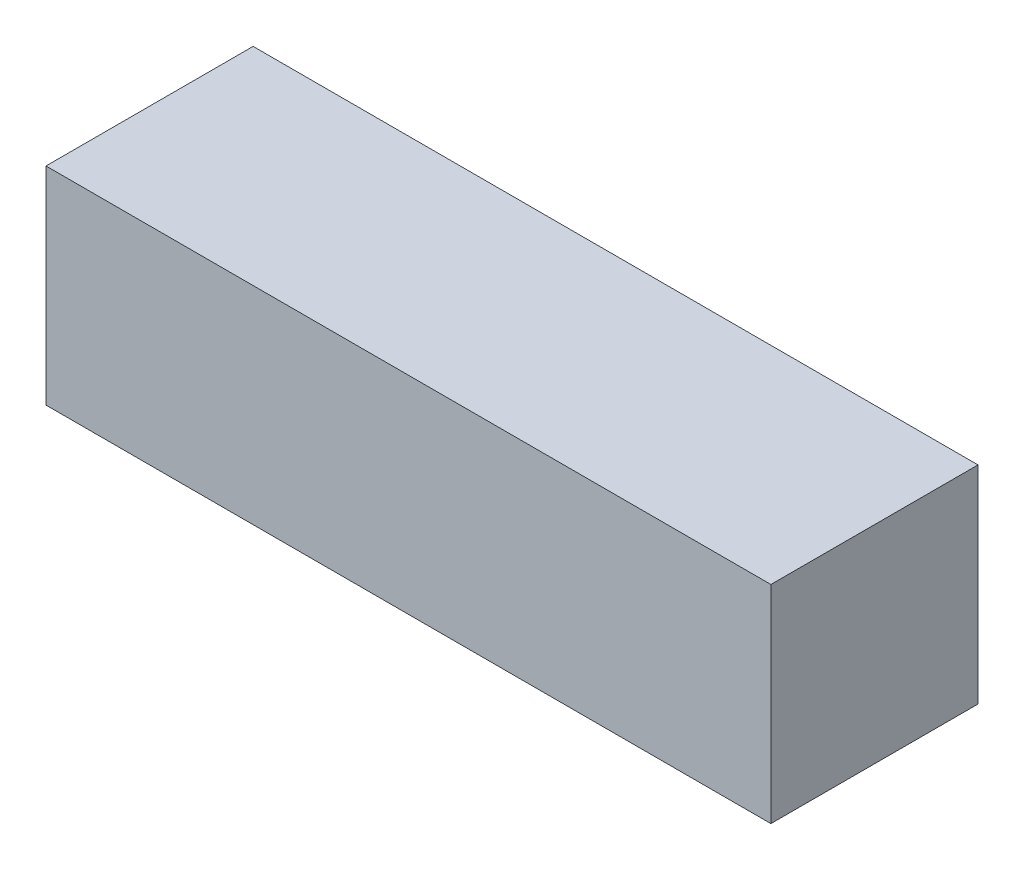
from build123d import *

# Parameters (mm, degrees)
DODANIE_WYCI_GNI_CIE1_DEPTH      = 10
DODANIE_WYCI_GNI_CIE1_DEPTH_BACK = 10
SZKIC1_W                         = 70
SZKIC1_H                         = 20


with BuildPart() as part:
    # Szkic1 → Dodanie-wyciągnięcie1 (new, two sides: drawn at the far end of the back side and taken through both)
    with BuildSketch(Plane.XY.offset(-DODANIE_WYCI_GNI_CIE1_DEPTH_BACK)):
        Rectangle(SZKIC1_W, SZKIC1_H)
    extrude(amount=DODANIE_WYCI_GNI_CIE1_DEPTH + DODANIE_WYCI_GNI_CIE1_DEPTH_BACK)


solid = part.part
